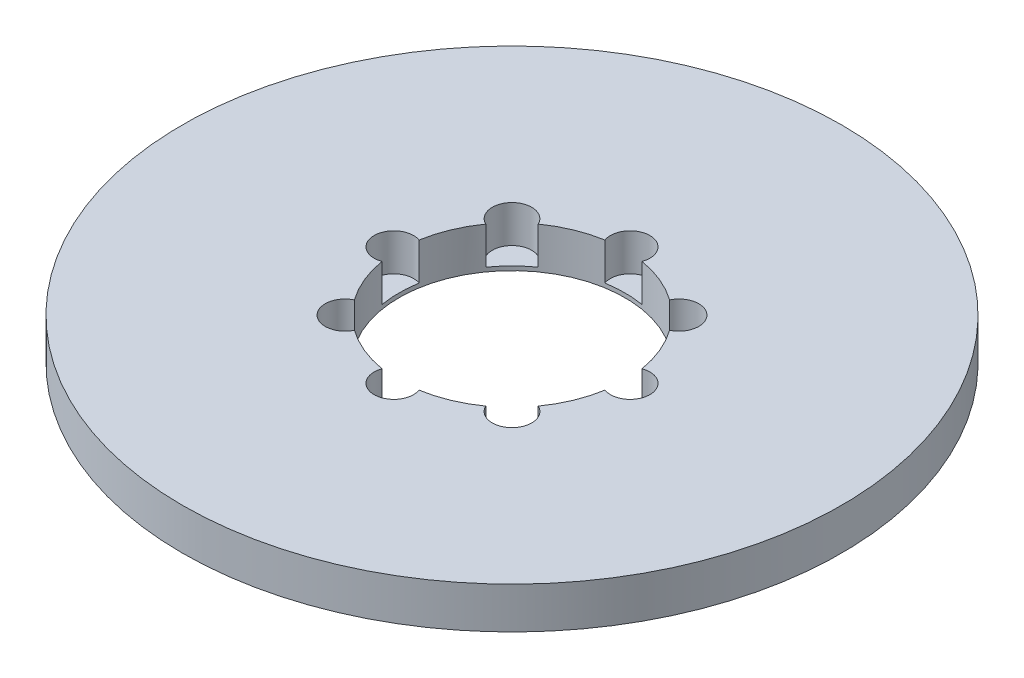
from build123d import *

# Parameters (mm, degrees)
SKETCH1_R           = 87.5
BOSS_EXTRUDE1_DEPTH = 11
SKETCH2_R           = 30
CUT_EXTRUDE1_DEPTH  = 125.231638482
SKETCH3_R           = 5.237009407
CUT_EXTRUDE2_DEPTH  = 9.893272855
CIRPATTERN1_COUNT   = 8


with BuildPart() as part:
    # Sketch1 → Boss-Extrude1 (new body)
    with BuildSketch(Plane(origin=(0, 0, 0), x_dir=(1, 0, 0), z_dir=(0, 1, 0))):
        Circle(SKETCH1_R)
    extrude(amount=BOSS_EXTRUDE1_DEPTH)

    # Sketch2 → Cut-Extrude1 (cut, through all)
    with BuildSketch(Plane(origin=(0, 0, 0), x_dir=(1, 0, 0), z_dir=(0, 1, 0))):
        Circle(SKETCH2_R)
    extrude(amount=CUT_EXTRUDE1_DEPTH, mode=Mode.SUBTRACT)

    # Sketch3 → Cut-Extrude2 (cut)
    with BuildSketch(Plane(origin=(0, 11, 0), x_dir=(1, 0, 0), z_dir=(0, 1, 0))):
        with Locations((-31.365051568, 0)):
            Circle(SKETCH3_R)
    cut_extrude2 = extrude(amount=-CUT_EXTRUDE2_DEPTH, mode=Mode.SUBTRACT)

    # CirPattern1: Cut-Extrude2 ×8 about axis
    cirpattern1_axis = Axis((0, 0, 0), (0, 1, 0))
    for i in range(1, CIRPATTERN1_COUNT):
        add(cut_extrude2.rotate(cirpattern1_axis, i * 360 / CIRPATTERN1_COUNT), mode=Mode.SUBTRACT)


solid = part.part
